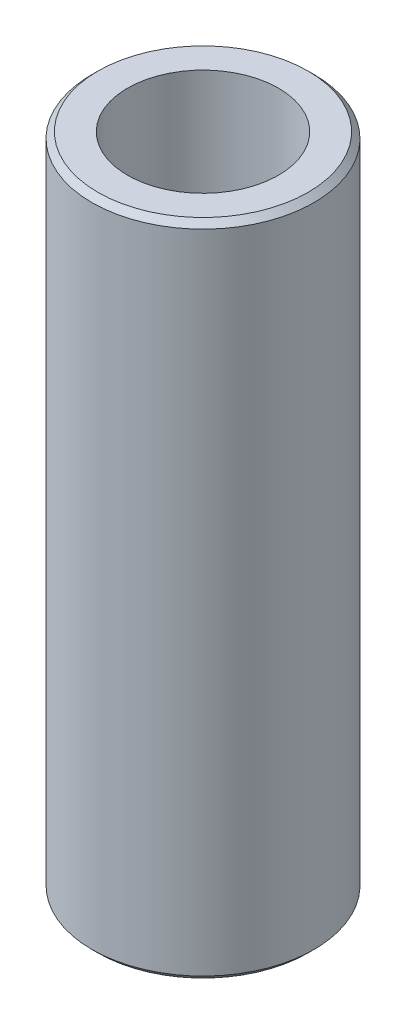
from build123d import *

# Parameters (mm, degrees)
SKETCH1_R           = 4.7625
BOSS_EXTRUDE1_DEPTH = 14.12875
CHAMFER1_SIZE       = 0.254
SKETCH2_R           = 3.2385
CUT_EXTRUDE1_DEPTH  = 30.049081203


with BuildPart() as part:
    # Sketch1 → Boss-Extrude1 (new, symmetric)
    with BuildSketch(Plane(origin=(0, 0, 0), x_dir=(1, 0, 0), z_dir=(0, 1, 0))):
        Circle(SKETCH1_R)
    extrude(amount=BOSS_EXTRUDE1_DEPTH, both=True)

    # Chamfer1
    chamfer1_edges = [part.edges().sort_by_distance(p)[0] for p in [
        (-4.7625, 14.12875, 0),
        (-4.7625, -14.12875, 0),
    ]]
    chamfer(chamfer1_edges, length=CHAMFER1_SIZE)

    # Sketch2 → Cut-Extrude1 (cut, through all)
    with BuildSketch(Plane.XZ.offset(14.12875)):
        Circle(SKETCH2_R)
    extrude(amount=-CUT_EXTRUDE1_DEPTH, mode=Mode.SUBTRACT)


solid = part.part
